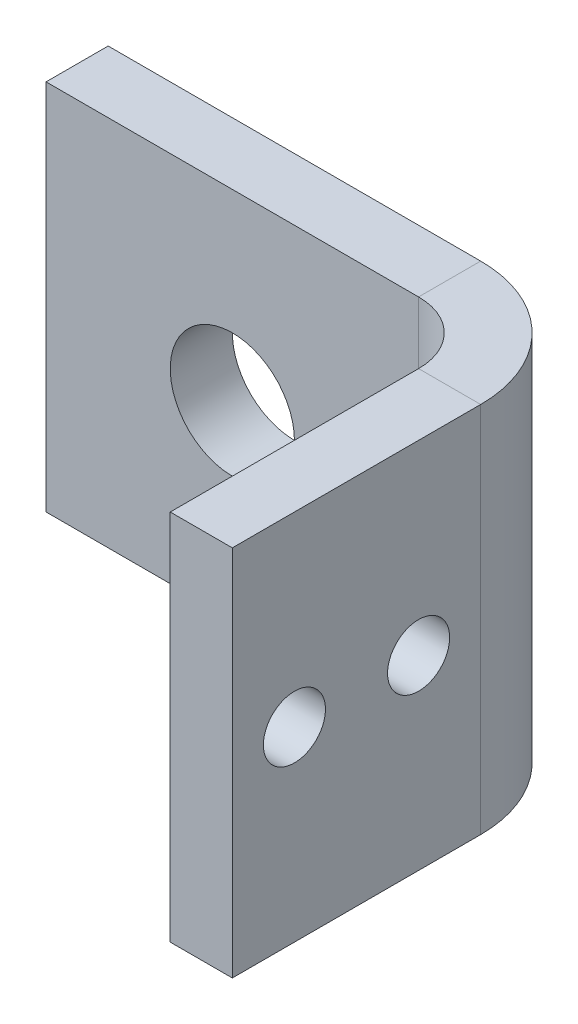
from build123d import *

# Parameters (mm, degrees)
SKETCH1_W          = 30
SKETCH1_H          = 30
BASE_FLANGE1_DEPTH = 5
SKETCH6_R          = 5
CUT_EXTRUDE1_DEPTH = 34.911649916
EDGE_FLANGE1_DEPTH = 30
HOLE1_START        = 5
HOLE1_OUTLINE_R    = 2.5
HOLE1_DEPTH        = 5
LPATTERN1_COUNT    = 2
LPATTERN1_PITCH    = 10


# Read off the part's stored shape, not the designer's step: Hole1
# Sheet-metal steps are written as plain solids
with BuildPart() as part:
    # Sketch1 → Base-Flange1 (new body)
    with BuildSketch(Plane.XY):
        with Locations((-15, 0)):
            Rectangle(SKETCH1_W, SKETCH1_H)
    extrude(amount=-BASE_FLANGE1_DEPTH)

    # Sketch6 → Cut-Extrude1 (cut, through all)
    with BuildSketch(Plane.XY):
        with Locations((-15, 0)):
            Circle(SKETCH6_R)
    extrude(amount=-CUT_EXTRUDE1_DEPTH, mode=Mode.SUBTRACT)

    # Edge-Flange1 section (across the edge) → Edge-Flange1 (add)
    with BuildSketch(Plane(origin=(5, -15, 0), x_dir=(-1, 0, 0), z_dir=(0, 1, 0))):
        with BuildLine():
            Line((-5, 5), (-5, 25))
            Line((-5, 25), (0, 25))
            Line((0, 25), (0, 5))
            ThreePointArc((0, 5), (1.464466094, 1.464466094), (5, 0))
            Line((5, 0), (5, -5))
            ThreePointArc((5, -5), (-2.071067812, -2.071067812), (-5, 5))
        make_face()
    extrude(amount=EDGE_FLANGE1_DEPTH)

    # Hole1 outline → Hole1 (cut)
    with BuildSketch(Plane.YZ.offset(HOLE1_START)):
        with Locations((0, 10)):
            Circle(HOLE1_OUTLINE_R)
    hole1 = extrude(amount=HOLE1_DEPTH, mode=Mode.SUBTRACT)

    # LPattern1: Hole1 ×2
    with Locations(*[(0, 0, i * LPATTERN1_PITCH) for i in range(1, LPATTERN1_COUNT)]):
        add(hole1, mode=Mode.SUBTRACT)


solid = part.part
